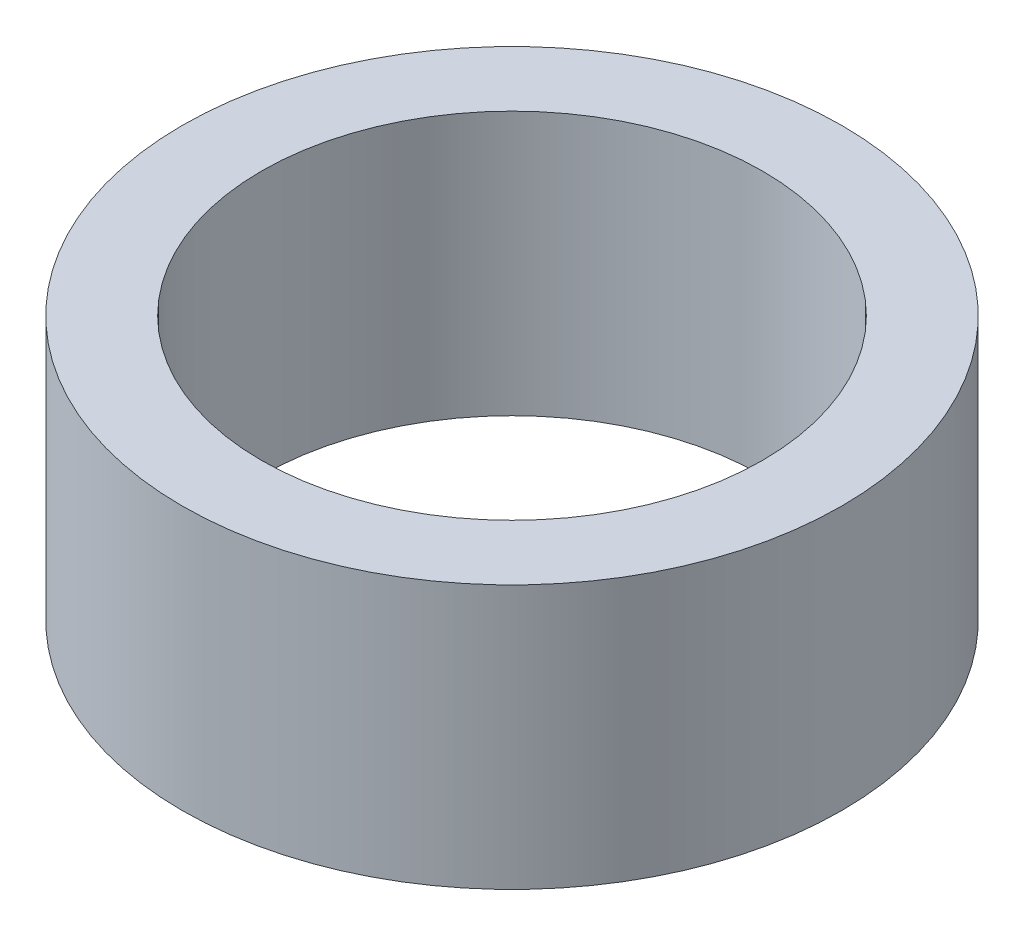
from build123d import *

# Parameters (mm, degrees)
SKETCH1_R           = 6.25
SKETCH1_R_2         = 4.75
BOSS_EXTRUDE1_DEPTH = 5


with BuildPart() as part:
    # Sketch1 → Boss-Extrude1 (new body)
    with BuildSketch(Plane(origin=(0, 0, 0), x_dir=(1, 0, 0), z_dir=(0, 1, 0))):
        Circle(SKETCH1_R)
        Circle(SKETCH1_R_2, mode=Mode.SUBTRACT)
    extrude(amount=BOSS_EXTRUDE1_DEPTH)


solid = part.part
